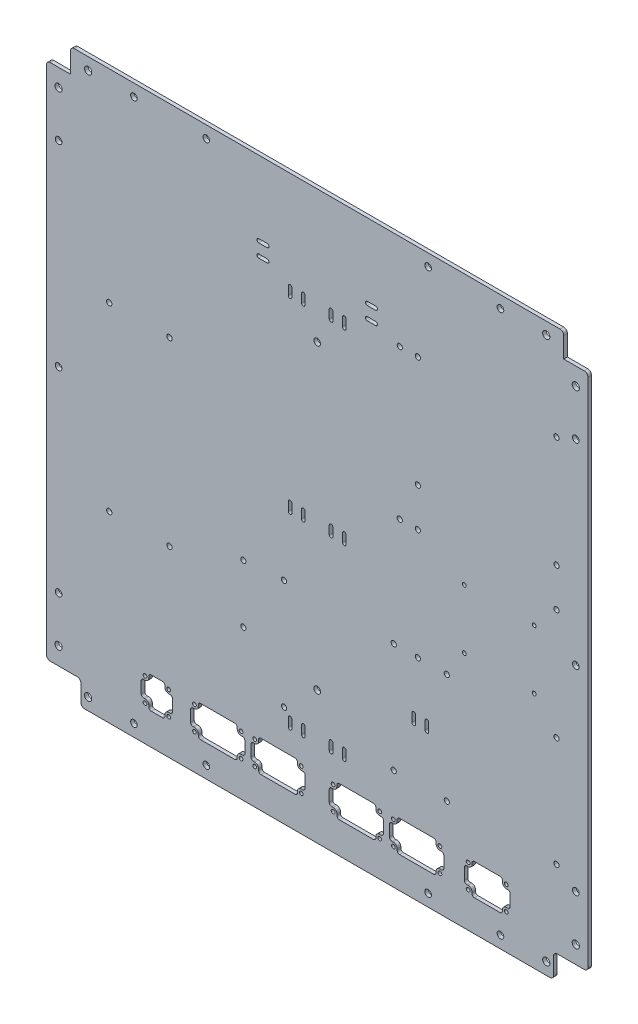
from build123d import *

# Parameters (mm, degrees)
SKETCH2_W                                      = 449
SKETCH2_H                                      = 470
BOSS_EXTRUDE1_DEPTH                            = 3
SKETCH3_W                                      = 20
SKETCH3_H                                      = 20
BED_HEATER_PANEL_CUTOUT_DEPTH                  = 30
M5_CLEARANCE_HOLE1_D                           = 5.5
EXTRUDER_PANEL_CUTOUTS_DEPTH                   = 651.007692262
Z_MOTOR_PANEL_CUTOUT_DEPTH                     = 10
FILLET1_R                                      = 3.175
SKETCH17_R                                     = 1.55
CUT_EXTRUDE3_DEPTH                             = 651.007692262
SKETCH7_R                                      = 2.15
DUET2_MOUNTING_HOLES_DEPTH                     = 651.007692262
SKETCH9_R                                      = 2.2
PSU_MOUNTING_HOLES_DEPTH                       = 651.007692262
SKETCH11_R                                     = 2.15
SSR_HOLES_DEPTH                                = 651.007692262
SKETCH18_R                                     = 2.15
SKETCH18_R_2                                   = 1.6
DUET3_EXPANDERS_AND_RASPI_HOLES_DEPTH          = 651.007692262
SKETCH12_R                                     = 3
INSIDE_CORNER_BRACKET_SCREW_CLEARANCE_HO_DEPTH = 651.007692262
SKETCH6_W                                      = 3
SKETCH6_H                                      = 10
SKETCH6_W_2                                    = 10
SKETCH6_H_2                                    = 3
MAIN_WIRING_TIE_DOWNS_DEPTH                    = 651.007692262
SKETCH13_W                                     = 8.5
SKETCH13_H                                     = 20
CUT_EXTRUDE1_DEPTH                             = 651.007692262
FILLET2_R                                      = 3
FILLET3_R                                      = 2
FILLET4_R                                      = 1.5


with BuildPart() as part:
    # Sketch2 → Boss-Extrude1 (new body)
    with BuildSketch(Plane.XY):
        with Locations((224.5, 235)):
            Rectangle(SKETCH2_W, SKETCH2_H)
    extrude(amount=BOSS_EXTRUDE1_DEPTH)

    # Sketch3 → bed heater panel cutout (cut)
    with BuildSketch(Plane(origin=(0, 0, 0), x_dir=(-1, 0, 0), z_dir=(0, 0, -1))):
        Polygon((-98.15, 52), (-98.15, 45.65), (-104.5, 45.65), (-104.5, 32.35), (-98.15, 32.35), (-98.15, 26), (-84.85, 26), (-84.85, 32.35), (-78.5, 32.35), (-78.5, 45.65), (-84.85, 45.65), (-84.85, 52), align=None)
        with Locations((-439, 10)):
            Rectangle(SKETCH3_W, SKETCH3_H)
        with Locations((-10, 10)):
            Rectangle(SKETCH3_W, SKETCH3_H)
        with Locations((-439, 460)):
            Rectangle(SKETCH3_W, SKETCH3_H)
        with Locations((-10, 460)):
            Rectangle(SKETCH3_W, SKETCH3_H)
    extrude(amount=-BED_HEATER_PANEL_CUTOUT_DEPTH, mode=Mode.SUBTRACT)

    # M5 Clearance Hole1 (through all)
    with Locations(Plane(origin=(0, 0, 0), x_dir=(-1, 0, 0), z_dir=(0, 0, -1))):
        with Locations((-10, 235), (-224.5, 360), (-224.5, 110), (-376.5, 460), (-72.5, 460), (-316.5, 460), (-132.5, 460), (-72.5, 10), (-132.5, 10), (-316.5, 10), (-376.5, 10), (-439, 397.5), (-439, 72.5), (-10, 72.5), (-10, 397.5), (-439, 235)):
            Hole(M5_CLEARANCE_HOLE1_D / 2)

    # Sketch10 → extruder panel cutouts (cut, through all)
    with BuildSketch(Plane(origin=(0, 0, 0), x_dir=(-1, 0, 0), z_dir=(0, 0, -1))):
        Polygon((-158.15, 52), (-158.15, 45.65), (-164.5, 45.65), (-164.5, 32.35), (-158.15, 32.35), (-158.15, 26), (-125.85, 26), (-125.85, 32.35), (-119.5, 32.35), (-119.5, 45.65), (-125.85, 45.65), (-125.85, 52), align=None)
        Polygon((-208.15, 52), (-208.15, 45.65), (-214.5, 45.65), (-214.5, 32.35), (-208.15, 32.35), (-208.15, 26), (-175.85, 26), (-175.85, 32.35), (-169.5, 32.35), (-169.5, 45.65), (-175.85, 45.65), (-175.85, 52), align=None)
        Polygon((-273.15, 52), (-240.85, 52), (-240.85, 45.65), (-234.5, 45.65), (-234.5, 32.35), (-240.85, 32.35), (-240.85, 26), (-273.15, 26), (-273.15, 32.35), (-279.5, 32.35), (-279.5, 45.65), (-273.15, 45.65), align=None)
        Polygon((-323.15, 52), (-290.85, 52), (-290.85, 45.65), (-284.5, 45.65), (-284.5, 32.35), (-290.85, 32.35), (-290.85, 26), (-323.15, 26), (-323.15, 32.35), (-329.5, 32.35), (-329.5, 45.65), (-323.15, 45.65), align=None)
    extrude(amount=-EXTRUDER_PANEL_CUTOUTS_DEPTH, mode=Mode.SUBTRACT)

    # Sketch16 → z_motor_panel_cutout (cut)
    with BuildSketch(Plane(origin=(0, 0, 0), x_dir=(-1, 0, 0), z_dir=(0, 0, -1))):
        Polygon((-378.15, 52), (-378.15, 45.65), (-384.5, 45.65), (-384.5, 32.35), (-378.15, 32.35), (-378.15, 26), (-352.85, 26), (-352.85, 32.35), (-346.5, 32.35), (-346.5, 45.65), (-352.85, 45.65), (-352.85, 52), align=None)
    extrude(amount=-Z_MOTOR_PANEL_CUTOUT_DEPTH, mode=Mode.SUBTRACT)

    # Fillet1
    fillet1_edges = [part.edges().sort_by_distance(p)[0] for p in [
        (125.85, 45.65, 1.5),
        (125.85, 32.35, 1.5),
        (158.15, 32.35, 1.5),
        (158.15, 45.65, 1.5),
        (175.85, 45.65, 1.5),
        (175.85, 32.35, 1.5),
        (208.15, 32.35, 1.5),
        (208.15, 45.65, 1.5),
        (273.15, 45.65, 1.5),
        (240.85, 45.65, 1.5),
        (240.85, 32.35, 1.5),
        (273.15, 32.35, 1.5),
        (323.15, 45.65, 1.5),
        (290.85, 45.65, 1.5),
        (290.85, 32.35, 1.5),
        (323.15, 32.35, 1.5),
        (352.85, 45.65, 1.5),
        (352.85, 32.35, 1.5),
        (378.15, 32.35, 1.5),
        (378.15, 45.65, 1.5),
        (84.85, 45.65, 1.5),
        (84.85, 32.35, 1.5),
        (98.15, 32.35, 1.5),
        (98.15, 45.65, 1.5),
    ]]
    fillet(fillet1_edges, radius=FILLET1_R)

    # Sketch17 → Cut-Extrude3 (cut, through all)
    with BuildSketch(Plane(origin=(0, 0, 0), x_dir=(-1, 0, 0), z_dir=(0, 0, -1))):
        with Locations((-381.325, 48.825)):
            Circle(SKETCH17_R)
        with Locations((-349.675, 48.825)):
            Circle(SKETCH17_R)
        with Locations((-349.675, 29.175)):
            Circle(SKETCH17_R)
        with Locations((-381.325, 29.175)):
            Circle(SKETCH17_R)
        with Locations((-326.325, 48.825)):
            Circle(SKETCH17_R)
        with Locations((-287.675, 48.825)):
            Circle(SKETCH17_R)
        with Locations((-287.675, 29.175)):
            Circle(SKETCH17_R)
        with Locations((-326.325, 29.175)):
            Circle(SKETCH17_R)
        with Locations((-276.325, 48.825)):
            Circle(SKETCH17_R)
        with Locations((-237.675, 48.825)):
            Circle(SKETCH17_R)
        with Locations((-237.675, 29.175)):
            Circle(SKETCH17_R)
        with Locations((-276.325, 29.175)):
            Circle(SKETCH17_R)
        with Locations((-211.325, 48.825)):
            Circle(SKETCH17_R)
        with Locations((-172.675, 48.825)):
            Circle(SKETCH17_R)
        with Locations((-172.675, 29.175)):
            Circle(SKETCH17_R)
        with Locations((-211.325, 29.175)):
            Circle(SKETCH17_R)
        with Locations((-161.325, 48.825)):
            Circle(SKETCH17_R)
        with Locations((-122.675, 48.825)):
            Circle(SKETCH17_R)
        with Locations((-122.675, 29.175)):
            Circle(SKETCH17_R)
        with Locations((-161.325, 29.175)):
            Circle(SKETCH17_R)
        with Locations((-101.325, 48.825)):
            Circle(SKETCH17_R)
        with Locations((-81.675, 48.825)):
            Circle(SKETCH17_R)
        with Locations((-101.325, 29.175)):
            Circle(SKETCH17_R)
        with Locations((-81.675, 29.175)):
            Circle(SKETCH17_R)
    extrude(amount=-CUT_EXTRUDE3_DEPTH, mode=Mode.SUBTRACT)

    # Sketch7 → Duet2 mounting holes (cut, through all)
    with BuildSketch(Plane(origin=(0, 0, 0), x_dir=(-1, 0, 0), z_dir=(0, 0, -1))):
        with Locations((-423, 391)):
            Circle(SKETCH7_R)
        with Locations((-308, 391)):
            Circle(SKETCH7_R)
        with Locations((-308, 299)):
            Circle(SKETCH7_R)
        with Locations((-423, 299)):
            Circle(SKETCH7_R)
        with Locations((-423, 267)):
            Circle(SKETCH7_R)
        with Locations((-308, 267)):
            Circle(SKETCH7_R)
        with Locations((-308, 175)):
            Circle(SKETCH7_R)
        with Locations((-423, 175)):
            Circle(SKETCH7_R)
    extrude(amount=-DUET2_MOUNTING_HOLES_DEPTH, mode=Mode.SUBTRACT)

    # Sketch9 → psu mounting holes (cut, through all)
    with BuildSketch(Plane(origin=(0, 0, 0), x_dir=(-1, 0, 0), z_dir=(0, 0, -1))):
        with Locations((-52, 302)):
            Circle(SKETCH9_R)
        with Locations((-102, 302)):
            Circle(SKETCH9_R)
        with Locations((-52, 152)):
            Circle(SKETCH9_R)
        with Locations((-102, 152)):
            Circle(SKETCH9_R)
    extrude(amount=-PSU_MOUNTING_HOLES_DEPTH, mode=Mode.SUBTRACT)

    # Sketch11 → ssr holes (cut, through all)
    with BuildSketch(Plane(origin=(0, 0, 0), x_dir=(-1, 0, 0), z_dir=(0, 0, -1))):
        with Locations((-163.25, 172.6)):
            Circle(SKETCH11_R)
        with Locations((-163.25, 124.6)):
            Circle(SKETCH11_R)
    extrude(amount=-SSR_HOLES_DEPTH, mode=Mode.SUBTRACT)

    # Sketch18 → Duet3, Expanders, and Raspi Holes (cut, through all)
    with BuildSketch(Plane(origin=(0, 0, 0), x_dir=(-1, 0, 0), z_dir=(0, 0, -1))):
        with Locations((-293, 391)):
            Circle(SKETCH18_R)
        with Locations((-293, 267)):
            Circle(SKETCH18_R)
        with Locations((-404.5, 246.5)):
            Circle(SKETCH18_R_2)
        with Locations((-346.5, 246.5)):
            Circle(SKETCH18_R_2)
        with Locations((-346.5, 197.5)):
            Circle(SKETCH18_R_2)
        with Locations((-404.5, 197.5)):
            Circle(SKETCH18_R_2)
        with Locations((-332, 175)):
            Circle(SKETCH18_R)
        with Locations((-332, 84)):
            Circle(SKETCH18_R)
        with Locations((-423, 84)):
            Circle(SKETCH18_R)
        with Locations((-288, 175)):
            Circle(SKETCH18_R)
        with Locations((-288, 84)):
            Circle(SKETCH18_R)
        with Locations((-197, 84)):
            Circle(SKETCH18_R)
        with Locations((-197, 175)):
            Circle(SKETCH18_R)
    extrude(amount=-DUET3_EXPANDERS_AND_RASPI_HOLES_DEPTH, mode=Mode.SUBTRACT)

    # Sketch12 → inside corner bracket screw clearance ho (cut, through all)
    with BuildSketch(Plane(origin=(0, 0, 0), x_dir=(-1, 0, 0), z_dir=(0, 0, -1))):
        with Locations((-414.5, 460)):
            Circle(SKETCH12_R)
        with Locations((-34.5, 460)):
            Circle(SKETCH12_R)
        with Locations((-439, 435.5)):
            Circle(SKETCH12_R)
        with Locations((-439, 34.5)):
            Circle(SKETCH12_R)
        with Locations((-414.5, 10)):
            Circle(SKETCH12_R)
        with Locations((-34.5, 10)):
            Circle(SKETCH12_R)
        with Locations((-10, 34.5)):
            Circle(SKETCH12_R)
        with Locations((-10, 435.5)):
            Circle(SKETCH12_R)
    extrude(amount=-INSIDE_CORNER_BRACKET_SCREW_CLEARANCE_HO_DEPTH, mode=Mode.SUBTRACT)

    # Sketch6 → main wiring tie-downs (cut, through all)
    with BuildSketch(Plane(origin=(0, 0, 0), x_dir=(-1, 0, 0), z_dir=(0, 0, -1))):
        with Locations((-247, 230)):
            Rectangle(SKETCH6_W, SKETCH6_H)
        with Locations((-236, 385)):
            Rectangle(SKETCH6_W, SKETCH6_H)
        with Locations((-247, 385)):
            Rectangle(SKETCH6_W, SKETCH6_H)
        with Locations((-236, 230)):
            Rectangle(SKETCH6_W, SKETCH6_H)
        with Locations((-213, 230)):
            Rectangle(SKETCH6_W, SKETCH6_H)
        with Locations((-202, 230)):
            Rectangle(SKETCH6_W, SKETCH6_H)
        with Locations((-202, 385)):
            Rectangle(SKETCH6_W, SKETCH6_H)
        with Locations((-213, 385)):
            Rectangle(SKETCH6_W, SKETCH6_H)
        with Locations((-247, 75)):
            Rectangle(SKETCH6_W, SKETCH6_H)
        with Locations((-236, 75)):
            Rectangle(SKETCH6_W, SKETCH6_H)
        with Locations((-213, 75)):
            Rectangle(SKETCH6_W, SKETCH6_H)
        with Locations((-179.5, 408.5)):
            Rectangle(SKETCH6_W_2, SKETCH6_H_2)
        with Locations((-269.5, 397.5)):
            Rectangle(SKETCH6_W_2, SKETCH6_H_2)
        with Locations((-269.5, 408.5)):
            Rectangle(SKETCH6_W_2, SKETCH6_H_2)
        with Locations((-179.5, 397.5)):
            Rectangle(SKETCH6_W_2, SKETCH6_H_2)
        with Locations((-202, 75)):
            Rectangle(SKETCH6_W, SKETCH6_H)
        with Locations((-315.5, 129.5)):
            Rectangle(SKETCH6_W, SKETCH6_H)
        with Locations((-304.5, 129.5)):
            Rectangle(SKETCH6_W, SKETCH6_H)
    extrude(amount=-MAIN_WIRING_TIE_DOWNS_DEPTH, mode=Mode.SUBTRACT)

    # Sketch13 → Cut-Extrude1 (cut, through all)
    with BuildSketch(Plane(origin=(0, 0, 0), x_dir=(-1, 0, 0), z_dir=(0, 0, -1))):
        with Locations((-424.75, 10)):
            Rectangle(SKETCH13_W, SKETCH13_H)
        with Locations((-24.25, 10)):
            Rectangle(SKETCH13_W, SKETCH13_H)
    extrude(amount=-CUT_EXTRUDE1_DEPTH, mode=Mode.SUBTRACT)

    # Fillet2
    fillet2_edges = [part.edges().sort_by_distance(p)[0] for p in [
        (420.5, 20, 1.5),
        (420.5, 0, 1.5),
        (28.5, 0, 1.5),
        (28.5, 20, 1.5),
        (0, 20, 1.5),
        (449, 450, 1.5),
        (429, 470, 1.5),
        (0, 450, 1.5),
        (20, 470, 1.5),
        (449, 20, 1.5),
    ]]
    fillet(fillet2_edges, radius=FILLET2_R)

    # Fillet3
    fillet3_edges = [part.edges().sort_by_distance(p)[0] for p in [
        (158.15, 52, 1.5),
        (125.85, 52, 1.5),
        (119.5, 45.65, 1.5),
        (119.5, 32.35, 1.5),
        (125.85, 26, 1.5),
        (158.15, 26, 1.5),
        (164.5, 32.35, 1.5),
        (164.5, 45.65, 1.5),
        (208.15, 52, 1.5),
        (175.85, 52, 1.5),
        (169.5, 45.65, 1.5),
        (169.5, 32.35, 1.5),
        (175.85, 26, 1.5),
        (208.15, 26, 1.5),
        (214.5, 32.35, 1.5),
        (214.5, 45.65, 1.5),
        (273.15, 52, 1.5),
        (240.85, 52, 1.5),
        (234.5, 45.65, 1.5),
        (234.5, 32.35, 1.5),
        (240.85, 26, 1.5),
        (273.15, 26, 1.5),
        (279.5, 32.35, 1.5),
        (279.5, 45.65, 1.5),
        (323.15, 52, 1.5),
        (290.85, 52, 1.5),
        (284.5, 45.65, 1.5),
        (284.5, 32.35, 1.5),
        (290.85, 26, 1.5),
        (323.15, 26, 1.5),
        (329.5, 32.35, 1.5),
        (329.5, 45.65, 1.5),
        (378.15, 52, 1.5),
        (352.85, 52, 1.5),
        (346.5, 45.65, 1.5),
        (346.5, 32.35, 1.5),
        (352.85, 26, 1.5),
        (378.15, 26, 1.5),
        (384.5, 32.35, 1.5),
        (384.5, 45.65, 1.5),
        (98.15, 52, 1.5),
        (84.85, 52, 1.5),
        (78.5, 45.65, 1.5),
        (78.5, 32.35, 1.5),
        (84.85, 26, 1.5),
        (98.15, 26, 1.5),
        (104.5, 32.35, 1.5),
        (104.5, 45.65, 1.5),
    ]]
    fillet(fillet3_edges, radius=FILLET3_R)

    # Fillet4
    fillet4_edges = [part.edges().sort_by_distance(p)[0] for p in [
        (200.5, 225, 1.5),
        (211.5, 225, 1.5),
        (234.5, 225, 1.5),
        (245.5, 225, 1.5),
        (248.5, 225, 1.5),
        (237.5, 225, 1.5),
        (214.5, 225, 1.5),
        (203.5, 225, 1.5),
        (203.5, 235, 1.5),
        (214.5, 235, 1.5),
        (237.5, 235, 1.5),
        (248.5, 235, 1.5),
        (245.5, 235, 1.5),
        (234.5, 235, 1.5),
        (211.5, 235, 1.5),
        (200.5, 235, 1.5),
        (264.5, 399, 1.5),
        (264.5, 410, 1.5),
        (274.5, 407, 1.5),
        (274.5, 396, 1.5),
        (274.5, 399, 1.5),
        (274.5, 410, 1.5),
        (264.5, 396, 1.5),
        (264.5, 407, 1.5),
        (245.5, 380, 1.5),
        (234.5, 380, 1.5),
        (237.5, 380, 1.5),
        (248.5, 380, 1.5),
        (234.5, 390, 1.5),
        (245.5, 390, 1.5),
        (237.5, 390, 1.5),
        (248.5, 390, 1.5),
        (214.5, 390, 1.5),
        (211.5, 390, 1.5),
        (211.5, 380, 1.5),
        (214.5, 380, 1.5),
        (203.5, 380, 1.5),
        (203.5, 390, 1.5),
        (200.5, 390, 1.5),
        (200.5, 380, 1.5),
        (174.5, 396, 1.5),
        (174.5, 399, 1.5),
        (184.5, 399, 1.5),
        (184.5, 396, 1.5),
        (184.5, 407, 1.5),
        (174.5, 407, 1.5),
        (174.5, 410, 1.5),
        (184.5, 410, 1.5),
        (214.5, 70, 1.5),
        (211.5, 70, 1.5),
        (214.5, 80, 1.5),
        (211.5, 80, 1.5),
        (200.5, 80, 1.5),
        (203.5, 80, 1.5),
        (203.5, 70, 1.5),
        (200.5, 70, 1.5),
        (245.5, 70, 1.5),
        (248.5, 70, 1.5),
        (248.5, 80, 1.5),
        (245.5, 80, 1.5),
        (237.5, 70, 1.5),
        (234.5, 70, 1.5),
        (237.5, 80, 1.5),
        (234.5, 80, 1.5),
        (317, 134.5, 1.5),
        (314, 134.5, 1.5),
        (306, 134.5, 1.5),
        (303, 134.5, 1.5),
        (317, 124.5, 1.5),
        (314, 124.5, 1.5),
        (306, 124.5, 1.5),
        (303, 124.5, 1.5),
    ]]
    fillet(fillet4_edges, radius=FILLET4_R - 0.0001)  # a hair under: the kernel refuses the full size


solid = part.part
